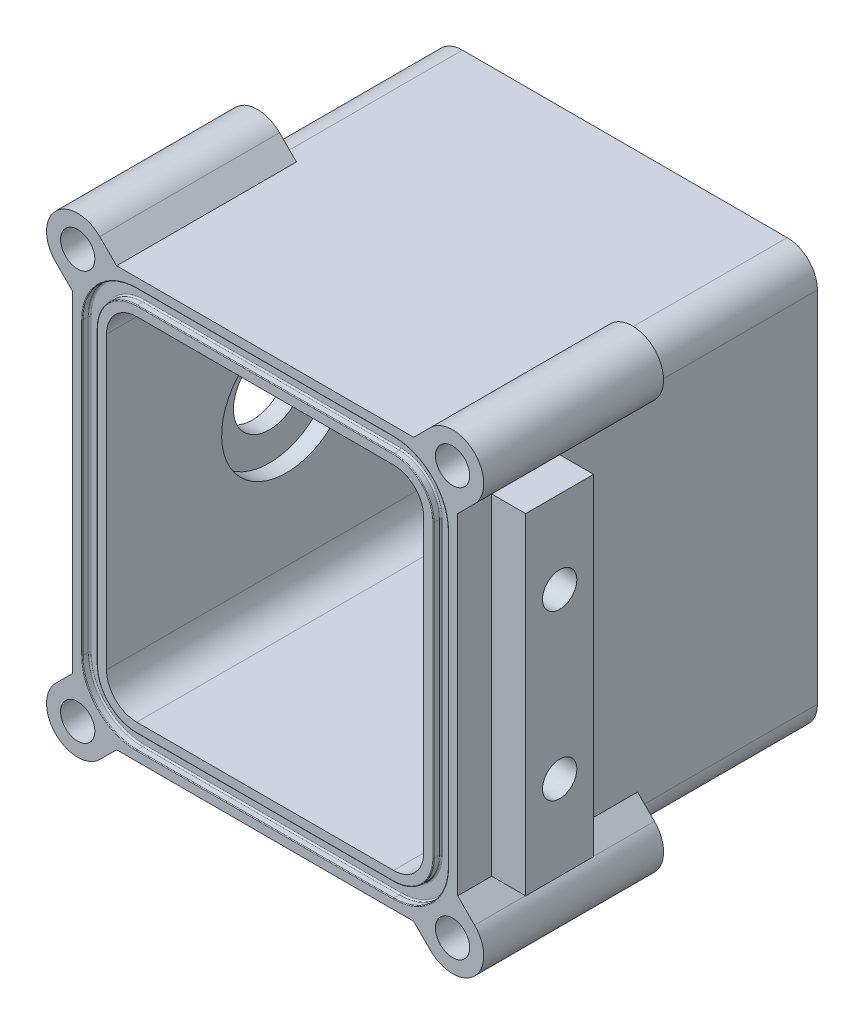
from build123d import *

# Parameters (mm, degrees)
BOSS_EXTRUDE1_DEPTH     = 31.75
SHELL1_T                = -6
FILLET1_R               = 5.334
CUT_EXTRUDE1_DEPTH      = 1.2954
FILLET2_R               = 0.254
FILLET3_R               = 0.127
BOSS_EXTRUDE2_DEPTH     = 31.75
SKETCH4_R               = 3.025
CUT_EXTRUDE2_DEPTH      = 9
MIRROR2_COPY_1_DEPTH    = 31.75
MIRROR2_COPY_2_SKETCH_R = 3.025
MIRROR2_COPY_2_DEPTH    = 9
SKETCH8_W               = 12
SKETCH8_H               = 58.443650814
BOSS_EXTRUDE3_DEPTH     = 6
SKETCH12_R              = 3.025
CUT_EXTRUDE6_DEPTH      = 9
SKETCH13_R              = 6.35
CUT_EXTRUDE10_DEPTH     = 6
SKETCH16_R              = 11.43
CUT_EXTRUDE14_DEPTH     = 3


with BuildPart() as part:
    # Sketch1 → Boss-Extrude1 (new, symmetric)
    with BuildSketch(Plane.XY):
        Polygon((-34, -37), (-34, -16.68), (-34, 16.68), (-34, 37), (34, 37), (34, -37), align=None)
    extrude(amount=BOSS_EXTRUDE1_DEPTH, both=True)

    # Shell1
    shell1_openings = [part.faces().sort_by_distance(p)[0] for p in [
        (0, 0, 31.75),
    ]]
    offset(amount=SHELL1_T, openings=shell1_openings, kind=Kind.INTERSECTION)

    # Fillet1
    fillet1_edges = [part.edges().sort_by_distance(p)[0] for p in [
        (34, 37, 0),
        (34, -37, 0),
        (-34, -37, 0),
        (-34, 37, 0),
        (28, 31, 3),
        (28, -31, 3),
        (-28, -31, 3),
        (-28, 31, 3),
    ]]
    fillet(fillet1_edges, radius=FILLET1_R)

    # Sketch2 → Cut-Extrude1 (cut)
    with BuildSketch(Plane.XY.offset(31.75)):
        with BuildLine():
            Line((32.2827, -25.666), (32.2827, 25.666))
            ThreePointArc((32.2827, 25.666), (29.466033783, 32.466033783), (22.666, 35.2827))
            Line((22.666, 35.2827), (-22.666, 35.2827))
            ThreePointArc((-22.666, 35.2827), (-29.466033783, 32.466033783), (-32.2827, 25.666))
            Line((-32.2827, 25.666), (-32.2827, -25.666))
            ThreePointArc((-32.2827, -25.666), (-29.466033783, -32.466033783), (-22.666, -35.2827))
            Line((-22.666, -35.2827), (22.666, -35.2827))
            ThreePointArc((22.666, -35.2827), (29.466033783, -32.466033783), (32.2827, -25.666))
        make_face()
        with BuildLine():
            Line((-29.7173, 25.666), (-29.7173, -25.666))
            ThreePointArc((-29.7173, -25.666), (-27.652022046, -30.652022046), (-22.666, -32.7173))
            Line((-22.666, -32.7173), (22.666, -32.7173))
            ThreePointArc((22.666, -32.7173), (27.652022046, -30.652022046), (29.7173, -25.666))
            Line((29.7173, -25.666), (29.7173, 25.666))
            ThreePointArc((29.7173, 25.666), (27.652022046, 30.652022046), (22.666, 32.7173))
            Line((22.666, 32.7173), (-22.666, 32.7173))
            ThreePointArc((-22.666, 32.7173), (-27.652022046, 30.652022046), (-29.7173, 25.666))
        make_face(mode=Mode.SUBTRACT)
    extrude(amount=-CUT_EXTRUDE1_DEPTH, mode=Mode.SUBTRACT)

    # Fillet2
    fillet2_edges = [part.edges().sort_by_distance(p)[0] for p in [
        (27.652022046, -30.652022046, 30.4546),
        (0, -32.7173, 30.4546),
        (-27.652022046, -30.652022046, 30.4546),
        (-29.7173, 0, 30.4546),
        (-27.652022046, 30.652022046, 30.4546),
        (0, 32.7173, 30.4546),
        (27.652022046, 30.652022046, 30.4546),
        (-29.466033783, 32.466033783, 30.4546),
        (0, 35.2827, 30.4546),
        (29.466033783, 32.466033783, 30.4546),
        (32.2827, 0, 30.4546),
        (29.466033783, -32.466033783, 30.4546),
        (0, -35.2827, 30.4546),
        (-29.466033783, -32.466033783, 30.4546),
        (29.7173, 0, 30.4546),
        (-32.2827, 0, 30.4546),
    ]]
    fillet(fillet2_edges, radius=FILLET2_R)

    # Fillet3
    fillet3_edges = [part.edges().sort_by_distance(p)[0] for p in [
        (-29.466033783, -32.466033783, 31.75),
        (-32.2827, 0, 31.75),
        (-29.466033783, 32.466033783, 31.75),
        (0, 35.2827, 31.75),
        (29.466033783, 32.466033783, 31.75),
        (32.2827, 0, 31.75),
        (29.466033783, -32.466033783, 31.75),
        (-27.652022046, -30.652022046, 31.75),
        (-29.7173, 0, 31.75),
        (-27.652022046, 30.652022046, 31.75),
        (0, 32.7173, 31.75),
        (27.652022046, 30.652022046, 31.75),
        (29.7173, 0, 31.75),
        (27.652022046, -30.652022046, 31.75),
        (0, -35.2827, 31.75),
        (0, -32.7173, 31.75),
    ]]
    fillet(fillet3_edges, radius=FILLET3_R)

    # Sketch3 → Boss-Extrude2 (add)
    with BuildSketch(Plane.XY.offset(31.75)):
        with BuildLine():
            ThreePointArc((30.741024965, -31.118858104), (29.555836344, -32.555836344), (28.118858104, -33.741024965))
            ThreePointArc((28.118858104, -33.741024965), (27.643498403, -35.335928432), (27.666944752, -37))
            Line((27.666944752, -37), (26.221825407, -37))
            Line((26.221825407, -37), (29.202282953, -39.980457546))
            ThreePointArc((29.202282953, -39.980457546), (36.980457546, -39.980457546), (36.980457546, -32.202282953))
            Line((36.980457546, -32.202282953), (34, -29.221825407))
            Line((34, -29.221825407), (34, -30.666944752))
            ThreePointArc((34, -30.666944752), (32.335928432, -30.643498403), (30.741024965, -31.118858104))
        make_face()
    boss_extrude2 = extrude(amount=-BOSS_EXTRUDE2_DEPTH)

    # Sketch4 → Cut-Extrude2 (cut)
    with BuildSketch(Plane.XY.offset(31.75)):
        with Locations((33.09137025, -36.09137025)):
            Circle(SKETCH4_R)
    cut_extrude2 = extrude(amount=-CUT_EXTRUDE2_DEPTH, mode=Mode.SUBTRACT)

    # Mirror1: Boss-Extrude2, Cut-Extrude2 across plane
    add(boss_extrude2.mirror(Plane.ZX))
    add(cut_extrude2.mirror(Plane.ZX), mode=Mode.SUBTRACT)

    # Mirror2: Boss-Extrude2, Cut-Extrude2 across plane
    add(boss_extrude2.mirror(Plane(origin=(0, 0, 0), x_dir=(0, 0, 1), z_dir=(1, 0, 0))))
    add(cut_extrude2.mirror(Plane(origin=(0, 0, 0), x_dir=(0, 0, 1), z_dir=(1, 0, 0))), mode=Mode.SUBTRACT)

    # Mirror2 copy 1 sketch → Mirror2 copy 1 (add)
    with BuildSketch(Plane(origin=(0, 0, 31.75), x_dir=(-1, 0, 0), z_dir=(0, 0, 1))):
        with BuildLine():
            ThreePointArc((30.741024965, -31.118858104), (29.555836344, -32.555836344), (28.118858104, -33.741024965))
            ThreePointArc((28.118858104, -33.741024965), (27.643498403, -35.335928432), (27.666944752, -37))
            Line((27.666944752, -37), (26.221825407, -37))
            Line((26.221825407, -37), (29.202282953, -39.980457546))
            ThreePointArc((29.202282953, -39.980457546), (36.980457546, -39.980457546), (36.980457546, -32.202282953))
            Line((36.980457546, -32.202282953), (34, -29.221825407))
            Line((34, -29.221825407), (34, -30.666944752))
            ThreePointArc((34, -30.666944752), (32.335928432, -30.643498403), (30.741024965, -31.118858104))
        make_face()
    extrude(amount=-MIRROR2_COPY_1_DEPTH)

    # Mirror2 copy 2 sketch → Mirror2 copy 2 (cut)
    with BuildSketch(Plane(origin=(0, 0, 31.75), x_dir=(-1, 0, 0), z_dir=(0, 0, 1))):
        with Locations((33.09137025, -36.09137025)):
            Circle(MIRROR2_COPY_2_SKETCH_R)
    extrude(amount=-MIRROR2_COPY_2_DEPTH, mode=Mode.SUBTRACT)

    # Sketch8 → Boss-Extrude3 (add)
    with BuildSketch(Plane.ZY.offset(34)):
        with Locations((19.75, 0)):
            Rectangle(SKETCH8_W, SKETCH8_H)
    boss_extrude3 = extrude(amount=BOSS_EXTRUDE3_DEPTH)

    # Sketch12 → Cut-Extrude6 (cut)
    with BuildSketch(Plane.ZY.offset(40)):
        with Locations((19.75, 14.616825407)):
            Circle(SKETCH12_R)
        with Locations((19.75, -14.339174593)):
            Circle(SKETCH12_R)
    cut_extrude6 = extrude(amount=-CUT_EXTRUDE6_DEPTH, mode=Mode.SUBTRACT)

    # Sketch13 → Cut-Extrude10 (cut)
    with BuildSketch(Plane.ZY.offset(34)):
        Circle(SKETCH13_R)
    extrude(amount=-CUT_EXTRUDE10_DEPTH, mode=Mode.SUBTRACT)

    # Sketch16 → Cut-Extrude14 (cut)
    with BuildSketch(Plane(origin=(-28, 0, 0), x_dir=(0, 0, -1), z_dir=(1, 0, 0))):
        Circle(SKETCH16_R)
    extrude(amount=-CUT_EXTRUDE14_DEPTH, mode=Mode.SUBTRACT)

    # Mirror5: Boss-Extrude3 across plane
    add(boss_extrude3.mirror(Plane(origin=(0, 0, 0), x_dir=(0, 0, 1), z_dir=(1, 0, 0))))

    # Mirror6: Cut-Extrude6 across plane
    add(cut_extrude6.mirror(Plane(origin=(0, 0, 0), x_dir=(0, 0, 1), z_dir=(1, 0, 0))), mode=Mode.SUBTRACT)


solid = part.part
